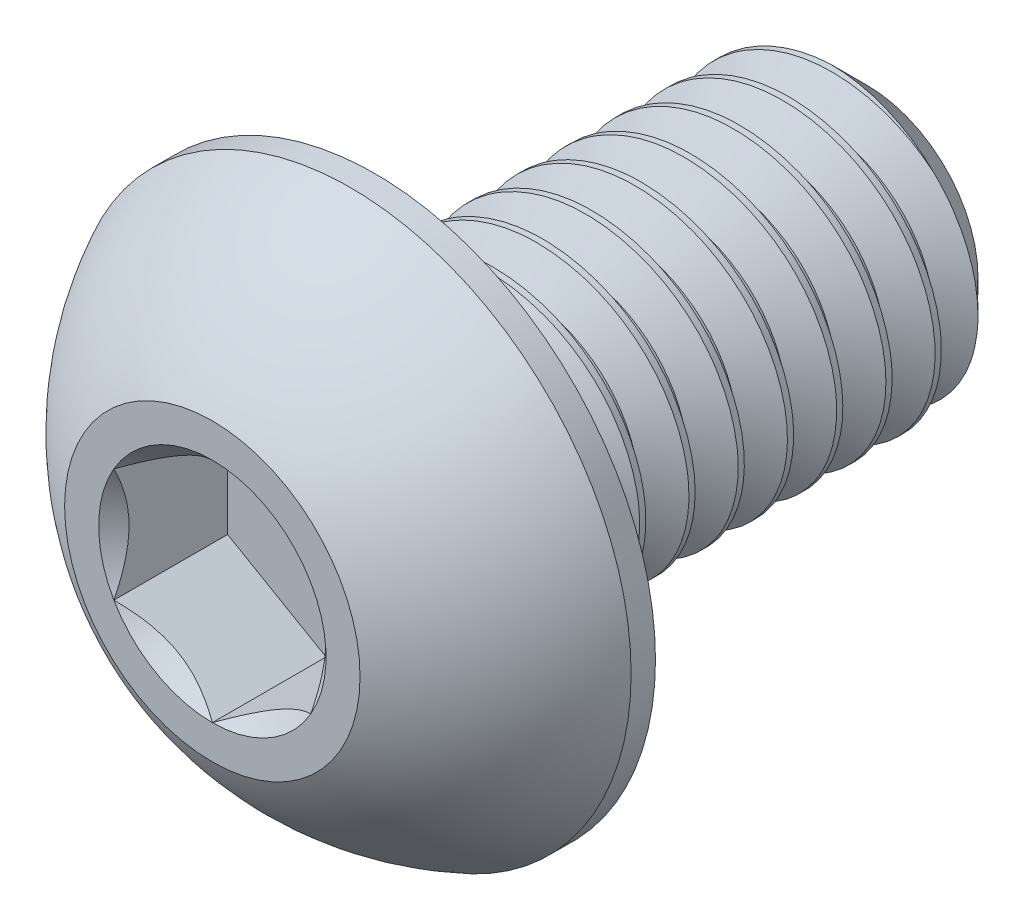
from build123d import *

# Parameters (mm, degrees)
SKETCH1_W          = 5
SKETCH1_H          = 1.5
CHAMFER1_SIZE      = 0.375
CUT_EXTRUDE2_DEPTH = 1.155
CUT_SWEEP1_PITCH   = 0.5


with BuildPart() as part:
    # Sketch1 → Revolve1 (revolve)
    with BuildSketch(Plane(origin=(0, 0, 0), x_dir=(0, 0, -1), z_dir=(1, 0, 0))):
        with Locations((4.15, 0.75)):
            Rectangle(SKETCH1_W, SKETCH1_H)
    revolve(axis=Axis((0, 0, -6.65), (0, 0, 1)))

    # Chamfer1
    chamfer1_edges = [part.edges().sort_by_distance(p)[0] for p in [
        (0, -1.5, -6.65),
    ]]
    chamfer(chamfer1_edges, length=CHAMFER1_SIZE)

    # Sketch7 → Revolve2 (revolve)
    with BuildSketch(Plane(origin=(0, 0, 0), x_dir=(0, 0, -1), z_dir=(1, 0, 0)), mode=Mode.PRIVATE) as revolve2_sk:
        with BuildLine():
            Line((1.4025, 2.85), (1.65, 2.85))
            Line((1.65, 2.85), (1.65, 0))
            Line((1.65, 0), (0, 0))
            Line((0, 0), (0, 1.5))
            ThreePointArc((0, 1.5), (0.59512511, 2.285251969), (1.4025, 2.85))
        make_face()
    revolve(revolve2_sk.sketch.rotate(Axis((0, 0, 0), (0, 0, -1)), 180), axis=Axis((0, 0, 0), (0, 0, -1)))

    # Sketch5 → Cut-Extrude2 (cut)
    with BuildSketch(Plane.XY):
        Polygon((1, -0.577350269), (1, 0.577350269), (0, 1.154700538), (-1, 0.577350269), (-1, -0.577350269), (0, -1.154700538), align=None)
    extrude(amount=-CUT_EXTRUDE2_DEPTH, mode=Mode.SUBTRACT)

    # Cut-Extrude3 cone 1 section (through the dimple's axis) → Cut-Extrude3 (revolve, cut)
    with BuildSketch(Plane(origin=(0, 0, 0), x_dir=(0, -1, 0), z_dir=(1, 0, 0))):
        Polygon((0, 0), (1.154700538, 0), (0, 1.154700538), align=None)
    revolve(axis=Axis((0, 0, 0), (0, 0, -1)), mode=Mode.SUBTRACT)

    # Cut-Sweep1: the profile of Sketch2 profile screwed along a right-hand helix of 11 turns, 6 arcs to a turn; built about Z, then put on its axis
    cut_sweep1_z = Axis((0, 0, 0), (0, 0, 1))
    cut_sweep1_corners = [(1.5003, 0, 0.375173205), (1.5003, 0, -0.062673205), (1.175240474, 0, 0.125), (1.175240474, 0, 0.1875)]
    with BuildLine(mode=Mode.PRIVATE) as cut_sweep1_profile:
        Line(cut_sweep1_corners[0], cut_sweep1_corners[1])
        Line(cut_sweep1_corners[1], cut_sweep1_corners[2])
        Line(cut_sweep1_corners[2], cut_sweep1_corners[3])
        Line(cut_sweep1_corners[3], cut_sweep1_corners[0])
    cut_sweep1_cap = Face(cut_sweep1_profile.wire())
    cut_sweep1_turn_angles = [0, 30, 60, 90, 120, 150, 180, 210, 240, 270, 300, 330, 360]
    cut_sweep1_turn_weights = [1, 0.8660254037844387, 1, 0.8660254037844387, 1, 0.8660254037844387, 1, 0.8660254037844387, 1, 0.8660254037844387, 1, 0.8660254037844387, 1]
    cut_sweep1_turn_rails = [Edge.make_bspline([Vector(p[0], p[1], 0).rotate(cut_sweep1_z, cut_sweep1_turn_angles[k]) / cut_sweep1_turn_weights[k] + Vector(0, 0, p[2] + CUT_SWEEP1_PITCH * cut_sweep1_turn_angles[k] / 360) for k in range(13)], [0, 0, 0, 1, 1, 2, 2, 3, 3, 4, 4, 5, 5, 6, 6, 6], 2, cut_sweep1_turn_weights) for p in cut_sweep1_corners]
    cut_sweep1_turn_sides = [Face.make_surface_from_curves(cut_sweep1_turn_rails[p[0]], cut_sweep1_turn_rails[p[1]]) for p in [(0, 1), (1, 2), (2, 3), (3, 0)]]
    cut_sweep1 = Plane(origin=(0, 0, -6.65), x_dir=(0, 1, 0), z_dir=(0, 0, 1)) * Solid(Shell([*[p.moved(Location((0, 0, CUT_SWEEP1_PITCH * i))) for i in range(11) for p in cut_sweep1_turn_sides], cut_sweep1_cap, cut_sweep1_cap.rotate(cut_sweep1_z, 3960).moved(Location((0, 0, CUT_SWEEP1_PITCH * 3960 / 360)))]))
    add(cut_sweep1, mode=Mode.SUBTRACT)


solid = part.part
